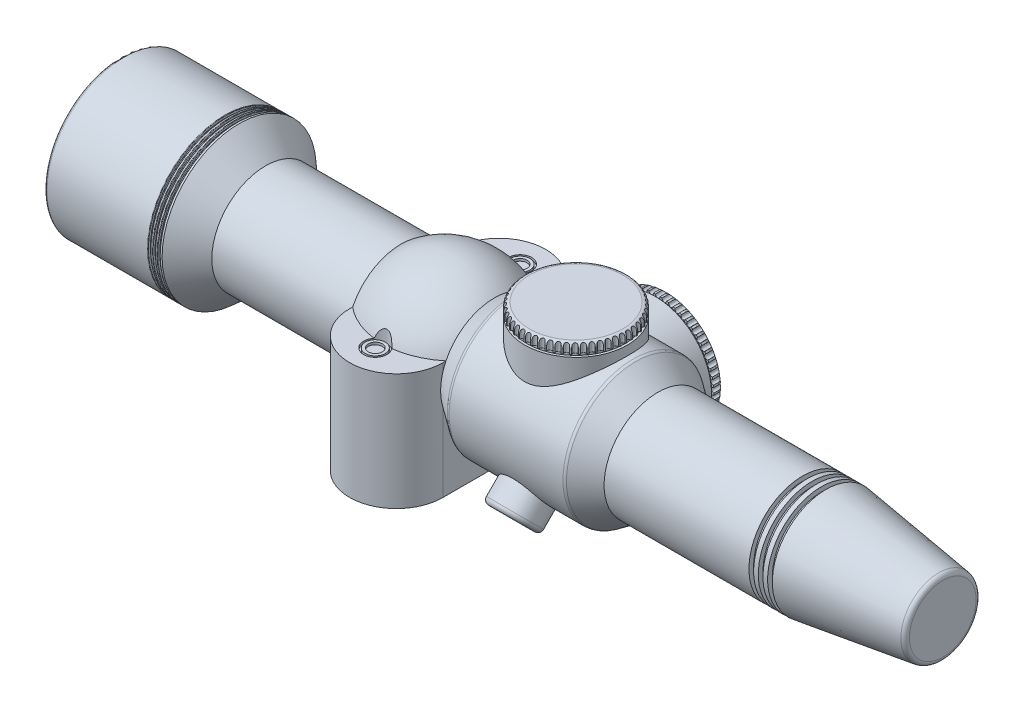
from build123d import *

# Parameters (mm, degrees)
SKETCH1_R                = 16.5
BOSS_EXTRUDE1_DEPTH      = 25.15
SKETCH2_R                = 14.125
CUT_EXTRUDE1_DEPTH       = 1
SKETCH3_R                = 13.125
CUT_EXTRUDE6_DEPTH       = 1
SKETCH14_R               = 12.125
CUT_EXTRUDE7_DEPTH       = 1
SKETCH15_R               = 11.125000000000002
CUT_EXTRUDE8_DEPTH       = 1
SKETCH16_R               = 10.125
CUT_EXTRUDE9_DEPTH       = 1
SKETCH17_R               = 9.125
CUT_EXTRUDE10_DEPTH      = 3
SKETCH21_R               = 11.500000000000002
SHAFT_DEPTH              = 120
SKETCH25_W               = 0.5
SKETCH25_H               = 0.5
FILLET1_R                = 0.1
FILLET2_R                = 0.5
SKETCH27_W               = 1
SKETCH27_H               = 1
SKETCH27_H_2             = 0.9999999999999982
BOSS_EXTRUDE2_DEPTH      = 5
BOSS_EXTRUDE2_DEPTH_BACK = 20
SKETCH29_R               = 2.750000000000008
CUT_EXTRUDE11_DEPTH      = 10
REVOLVE7_ANGLE           = 180.0000000000004
CUT_EXTRUDE12_START      = -0.5
SKETCH31_R               = 2.4999999999999956
CUT_EXTRUDE12_DEPTH      = 10.5
SKETCH32_R               = 2.125000000000003
SKETCH32_R_2             = 1.4999999999999973
BOSS_EXTRUDE3_DEPTH      = 0.5
SKETCH34_R               = 11.99999999999999
BOSS_EXTRUDE4_DEPTH      = 19.5
FILLET3_R                = 1
SKETCH36_W               = 0.5
SKETCH36_H               = 0.5
CUT_EXTRUDE13_REACH      = 183.51
SKETCH39_R               = 0.49999999999999917
CIRPATTERN1_COUNT        = 53
SKETCH40_R               = 10.999999999999993
BOSS_EXTRUDE5_DEPTH      = 19.5
SKETCH41_R               = 5.000000000000004
BOSS_EXTRUDE6_DEPTH      = 19.5
FILLET4_R                = 1
SKETCH43_W               = 0.5
SKETCH43_H               = 0.5
FILLET5_R                = 1
CUT_EXTRUDE14_REACH      = 183.403
SKETCH44_R               = 0.49999999999999917
CIRPATTERN2_COUNT        = 53


with BuildPart() as part:
    # Sketch1 → Boss-Extrude1 (new body)
    with BuildSketch(Plane(origin=(0, 0, 0), x_dir=(0, 0, -1), z_dir=(1, 0, 0))):
        with Locations(Location((0, 0, 0), (0, 0, 180))):
            Circle(SKETCH1_R)
    extrude(amount=BOSS_EXTRUDE1_DEPTH)

    # Sketch2 → Cut-Extrude1 (cut)
    with BuildSketch(Plane.ZY):
        Circle(SKETCH2_R)
    extrude(amount=-CUT_EXTRUDE1_DEPTH, mode=Mode.SUBTRACT)

    # Sketch3 → Cut-Extrude6 (cut)
    with BuildSketch(Plane.ZY.offset(-1)):
        Circle(SKETCH3_R)
    extrude(amount=-CUT_EXTRUDE6_DEPTH, mode=Mode.SUBTRACT)

    # Sketch14 → Cut-Extrude7 (cut)
    with BuildSketch(Plane.ZY.offset(-2)):
        Circle(SKETCH14_R)
    extrude(amount=-CUT_EXTRUDE7_DEPTH, mode=Mode.SUBTRACT)

    # Sketch15 → Cut-Extrude8 (cut)
    with BuildSketch(Plane.ZY.offset(-3)):
        Circle(SKETCH15_R)
    extrude(amount=-CUT_EXTRUDE8_DEPTH, mode=Mode.SUBTRACT)

    # Sketch16 → Cut-Extrude9 (cut)
    with BuildSketch(Plane.ZY.offset(-4)):
        Circle(SKETCH16_R)
    extrude(amount=-CUT_EXTRUDE9_DEPTH, mode=Mode.SUBTRACT)

    # Sketch17 → Cut-Extrude10 (cut)
    with BuildSketch(Plane.ZY.offset(-5)):
        Circle(SKETCH17_R)
    extrude(amount=-CUT_EXTRUDE10_DEPTH, mode=Mode.SUBTRACT)

    # Sketch18 → Revolve1 (revolve)
    with BuildSketch(Plane(origin=(0, 0, 0), x_dir=(1, 0, 0), z_dir=(0, 1, 0))):
        with BuildLine():
            Line((6.467108158178063, 0), (8, 0))
            Line((8, 0), (8, 9.125))
            add(Edge.make_bspline(
                [(8, 9.125), (6.467108158178799, 4.562499999997817), (6.467108158178063, 0)],
                knots=[0, 0, 0, 0.49999999999976064, 0.49999999999976064, 0.49999999999976064], degree=2))
        make_face()
    revolve(axis=Axis((25.15, 0, 0), (-1, 0, 0)))

    # Sketch20 → Revolve5 (revolve)
    with BuildSketch(Plane(origin=(0, 0, 0), x_dir=(1, 0, 0), z_dir=(0, 1, 0)), mode=Mode.PRIVATE) as revolve5_sk:
        Polygon((30.8, 11.5), (25.15, 16.5), (25.15, 0), (30.8, 0), align=None)
    revolve(revolve5_sk.sketch.rotate(Axis((25.15, 0, 0), (1, 0, 0)), 180), axis=Axis((25.15, 0, 0), (1, 0, 0)))

    # Sketch21 → Shaft (add)
    with BuildSketch(Plane(origin=(30.8, 0, 0), x_dir=(0, 0, -1), z_dir=(1, 0, 0))):
        Circle(SKETCH21_R)
    extrude(amount=SHAFT_DEPTH)

    # Sketch25 → Cut-Revolve13 (revolve, cut)
    with BuildSketch(Plane(origin=(0, 0, 0), x_dir=(1, 0, 0), z_dir=(0, 1, 0)), mode=Mode.PRIVATE) as cut_revolve13_sk:
        with Locations((23.399999999999995, 16.25)):
            Rectangle(SKETCH25_W, SKETCH25_H)
        with Locations((24.399999999999995, 16.25)):
            Rectangle(SKETCH25_W, SKETCH25_H)
        with Locations((22.399999999999995, 16.25)):
            Rectangle(SKETCH25_W, SKETCH25_H)
    revolve(cut_revolve13_sk.sketch.rotate(Axis((25.15, 0, 0), (-1, 0, 0)), 180), axis=Axis((25.15, 0, 0), (-1, 0, 0)), mode=Mode.SUBTRACT)

    # Fillet1
    fillet1_edges = [part.edges().sort_by_distance(p)[0] for p in [
        (24.15, 4.04e-15, -16.5),
        (24.65, 4.04e-15, -16.5),
        (23.15, 4.04e-15, -16.5),
        (23.65, 4.04e-15, -16.5),
        (22.149999999999995, 4.04e-15, -16.5),
        (22.649999999999995, 4.04e-15, -16.5),
    ]]
    fillet(fillet1_edges, radius=FILLET1_R)

    # Fillet2
    fillet2_edges = [part.edges().sort_by_distance(p)[0] for p in [
        (0, -4.04e-15, -16.5),
    ]]
    fillet(fillet2_edges, radius=FILLET2_R)

    # Sketch26 → Revolve6 (revolve)
    with BuildSketch(Plane(origin=(0, 0, 0), x_dir=(1, 0, 0), z_dir=(0, 1, 0)), mode=Mode.PRIVATE) as revolve6_sk:
        with BuildLine():
            Line((150.79999999999998, -11.500000000000002), (150.79999999999998, 0))
            Line((150.79999999999998, 0), (175.79999999999998, 0))
            Line((175.79999999999998, 0), (175.79999999999998, -7.130247555090847))
            ThreePointArc((175.79999999999998, -7.130247555090847), (175.5545355672645, -7.7865067094900855), (174.9386478445344, -8.120589301765184))
            Line((174.9386478445344, -8.120589301765184), (150.79999999999998, -11.500000000000002))
        make_face()
    revolve(revolve6_sk.sketch.rotate(Axis((150.79999999999998, 0, 0), (-1, 0, 0)), 180), axis=Axis((150.79999999999998, 0, 0), (-1, 0, 0)))

    # Sketch27 → Cut-Revolve14 (revolve, cut)
    with BuildSketch(Plane(origin=(0, 0, 0), x_dir=(1, 0, 0), z_dir=(0, 1, 0)), mode=Mode.PRIVATE) as cut_revolve14_sk:
        with Locations((148.29999999999998, -11.000000000000016)):
            Rectangle(SKETCH27_W, SKETCH27_H)
        with Locations((150.29999999999998, -11.000000000000002)):
            Rectangle(SKETCH27_W, SKETCH27_H)
        with Locations((146.29999999999998, -11.000000000000028)):
            Rectangle(SKETCH27_W, SKETCH27_H_2)
    revolve(cut_revolve14_sk.sketch.rotate(Axis((150.79999999999998, 0, 0), (-1, 0, 0)), 180), axis=Axis((150.79999999999998, 0, 0), (-1, 0, 0)), mode=Mode.SUBTRACT)

    # Sketch28 → Boss-Extrude2 (add, two sides: drawn at the far end of the back side and taken through both)
    with BuildSketch(Plane(origin=(0, 0, 0), x_dir=(1, 0, 0), z_dir=(0, 1, 0)).offset(-BOSS_EXTRUDE2_DEPTH_BACK)):
        with BuildLine():
            Line((59.800000000000004, 11.000000000000016), (59.800000000000004, -10.999999999999984))
            ThreePointArc((59.800000000000004, -10.999999999999984), (69.8, -20.999999999999975), (79.8, -10.999999999999982))
            Line((79.8, -10.999999999999982), (79.8, 11.000000000000018))
            ThreePointArc((79.8, 11.000000000000018), (69.8, 21.000000000000014), (59.800000000000004, 11.000000000000016))
        make_face()
    extrude(amount=BOSS_EXTRUDE2_DEPTH + BOSS_EXTRUDE2_DEPTH_BACK)

    # Sketch29 → Cut-Extrude11 (cut)
    with BuildSketch(Plane.XZ.offset(20)):
        with Locations(Location((69.8, -11.000000000000016, 0), (0, 0, 270))):
            Circle(SKETCH29_R)
        with Locations(Location((69.8, 6.999999999999981, 0), (0, 0, 270))):
            Circle(SKETCH29_R)
    extrude(amount=-CUT_EXTRUDE11_DEPTH, mode=Mode.SUBTRACT)

    # Sketch30 → Revolve7 (revolve)
    with BuildSketch(Plane(origin=(0, 0, 0), x_dir=(1, 0, 0), z_dir=(0, 1, 0))):
        with BuildLine():
            Line((59.81250782228093, 11.500000000000002), (79.78749217771909, 11.500000000000002))
            ThreePointArc((79.78749217771909, 11.500000000000002), (69.80000000000001, 14.856157588603978), (59.81250782228093, 11.500000000000002))
        make_face()
    revolve(axis=Axis((150.79999999999998, 0, 0), (1, 0, 0)), revolution_arc=REVOLVE7_ANGLE)

    # Sketch31 → Cut-Extrude12 (cut)
    with BuildSketch(Plane(origin=(0, 5, 0), x_dir=(1, 0, 0), z_dir=(0, 1, 0)).offset(CUT_EXTRUDE12_START)):
        with Locations(Location((69.8, 15.50000000000001, 0), (0, 0, 319.408084377))):
            Circle(SKETCH31_R)
    cut_extrude12 = extrude(amount=CUT_EXTRUDE12_DEPTH, mode=Mode.SUBTRACT)

    # Sketch32 → Boss-Extrude3 (add)
    with BuildSketch(Plane(origin=(0, 4.500000000000001, 0), x_dir=(1, 0, 0), z_dir=(0, 1, 0))):
        with Locations(Location((69.8, 15.50000000000001, 0), (0, 0, 270))):
            Circle(SKETCH32_R)
        with Locations(Location((69.8, 15.50000000000001, 0), (0, 0, 270))):
            Circle(SKETCH32_R_2, mode=Mode.SUBTRACT)
    boss_extrude3 = extrude(amount=BOSS_EXTRUDE3_DEPTH)

    # Mirror2: Cut-Extrude12, Boss-Extrude3 across plane
    add(cut_extrude12.mirror(Plane.XY), mode=Mode.SUBTRACT)
    add(boss_extrude3.mirror(Plane.XY))

    # Sketch33 → Revolve8 (revolve)
    with BuildSketch(Plane(origin=(0, 0, 0), x_dir=(1, 0, 0), z_dir=(0, 1, 0))):
        with BuildLine():
            Line((79.78749217771909, 11.500000000000002), (84.52925206417486, 14.819231920519037))
            ThreePointArc((84.52925206417486, 14.819231920519037), (84.8020750236591, 14.953737888656791), (85.1027144085382, 15))
            Line((85.1027144085382, 15), (109.4722699469, 15))
            ThreePointArc((109.4722699469, 15), (109.77290933177909, 14.953737888656795), (110.04573229126333, 14.819231920519037))
            Line((110.04573229126333, 14.819231920519037), (114.7874921777191, 11.500000000000002))
            Line((114.7874921777191, 11.500000000000002), (79.78749217771909, 11.500000000000002))
        make_face()
    revolve(axis=Axis((150.79999999999998, 0, 0), (-1, 0, 0)))

    # Sketch34 → Boss-Extrude4 (add)
    with BuildSketch(Plane.XY):
        with Locations((97.2874921777191, 0)):
            Circle(SKETCH34_R)
    extrude(amount=-BOSS_EXTRUDE4_DEPTH)

    # Fillet3
    fillet3_edges = [part.edges().sort_by_distance(p)[0] for p in [
        (85.28749217771912, 1.47e-15, -19.5),
    ]]
    fillet(fillet3_edges, radius=FILLET3_R)

    # Sketch36 → Cut-Revolve15 (revolve, cut)
    with BuildSketch(Plane(origin=(0, 0, 0), x_dir=(1, 0, 0), z_dir=(0, 1, 0))):
        with Locations((85.53749217771912, 17.249999999999996)):
            Rectangle(SKETCH36_W, SKETCH36_H)
    revolve(axis=Axis((97.2874921777191, 0, -19.5), (0, 0, 1)), mode=Mode.SUBTRACT)

    # Sketch39 → Cut-Extrude13 (cut, up to next)
    with BuildSketch(Plane(origin=(0, 0, -19.5), x_dir=(-1, 0, 0), z_dir=(0, 0, -1)), mode=Mode.PRIVATE) as cut_extrude13_sk1:
        with Locations((-97.2874921777191, 11.999999999999996)):
            Circle(SKETCH39_R)
    cut_extrude13_tool1 = extrude(cut_extrude13_sk1.sketch, amount=-CUT_EXTRUDE13_REACH, mode=Mode.PRIVATE) & part.part
    cut_extrude13 = cut_extrude13_tool1.solids().sort_by_distance((97.287492, 12, -19.5))[0]
    add(cut_extrude13, mode=Mode.SUBTRACT)

    # CirPattern1: Cut-Extrude13 ×53 about axis
    cirpattern1_axis = Axis((97.28749217771906, -2.02e-15, 0), (0, 0, 1))
    for i in range(1, CIRPATTERN1_COUNT):
        add(cut_extrude13.rotate(cirpattern1_axis, i * 360 / CIRPATTERN1_COUNT), mode=Mode.SUBTRACT)

    # Sketch40 → Boss-Extrude5 (add)
    with BuildSketch(Plane(origin=(0, 0, 0), x_dir=(1, 0, 0), z_dir=(0, 1, 0))):
        with Locations(Location((97.2874921777191, 0, 0), (0, 0, 113.988784525))):
            Circle(SKETCH40_R)
    extrude(amount=BOSS_EXTRUDE5_DEPTH)

    # Sketch41 → Boss-Extrude6 (add)
    with BuildSketch(Plane(origin=(0, 0, 0), x_dir=(-1, 0, 0), z_dir=(0, 0.7071067811865475, -0.7071067811865477))):
        with Locations(Location((-97.2874921777191, 0, 0), (0, 0, 90))):
            Circle(SKETCH41_R)
    extrude(amount=-BOSS_EXTRUDE6_DEPTH)

    # Fillet4
    fillet4_edges = [part.edges().sort_by_distance(p)[0] for p in [
        (97.2874921777191, -17.32411613907042, 10.25304832720494),
    ]]
    fillet(fillet4_edges, radius=FILLET4_R)

    # Sketch43 → Cut-Revolve16 (revolve, cut)
    with BuildSketch(Plane.XY, mode=Mode.PRIVATE) as cut_revolve16_sk:
        with Locations((108.0374921777191, 17.25)):
            Rectangle(SKETCH43_W, SKETCH43_H)
    revolve(cut_revolve16_sk.sketch.rotate(Axis((97.2874921777191, 19.5, 0), (0, -1, 0)), 90), axis=Axis((97.2874921777191, 19.5, 0), (0, -1, 0)), mode=Mode.SUBTRACT)

    # Fillet5
    fillet5_edges = [part.edges().sort_by_distance(p)[0] for p in [
        (101.75962810458138, 19.5, 10.049875633641816),
    ]]
    fillet(fillet5_edges, radius=FILLET5_R)

    # Sketch44 → Cut-Extrude14 (cut, up to next)
    with BuildSketch(Plane(origin=(0, 19.5, 0), x_dir=(1, 0, 0), z_dir=(0, 1, 0)), mode=Mode.PRIVATE) as cut_extrude14_sk1:
        with Locations((97.28749217771912, 10.999999999999986)):
            Circle(SKETCH44_R)
    cut_extrude14_tool1 = extrude(cut_extrude14_sk1.sketch, amount=-CUT_EXTRUDE14_REACH, mode=Mode.PRIVATE) & part.part
    cut_extrude14 = cut_extrude14_tool1.solids().sort_by_distance((97.287492, 19.5, -11))[0]
    add(cut_extrude14, mode=Mode.SUBTRACT)

    # CirPattern2: Cut-Extrude14 ×53 about axis
    cirpattern2_axis = Axis((97.28749217771906, 0, -6e-17), (0, 1, 0))
    for i in range(1, CIRPATTERN2_COUNT):
        add(cut_extrude14.rotate(cirpattern2_axis, i * 360 / CIRPATTERN2_COUNT), mode=Mode.SUBTRACT)


solid = part.part
